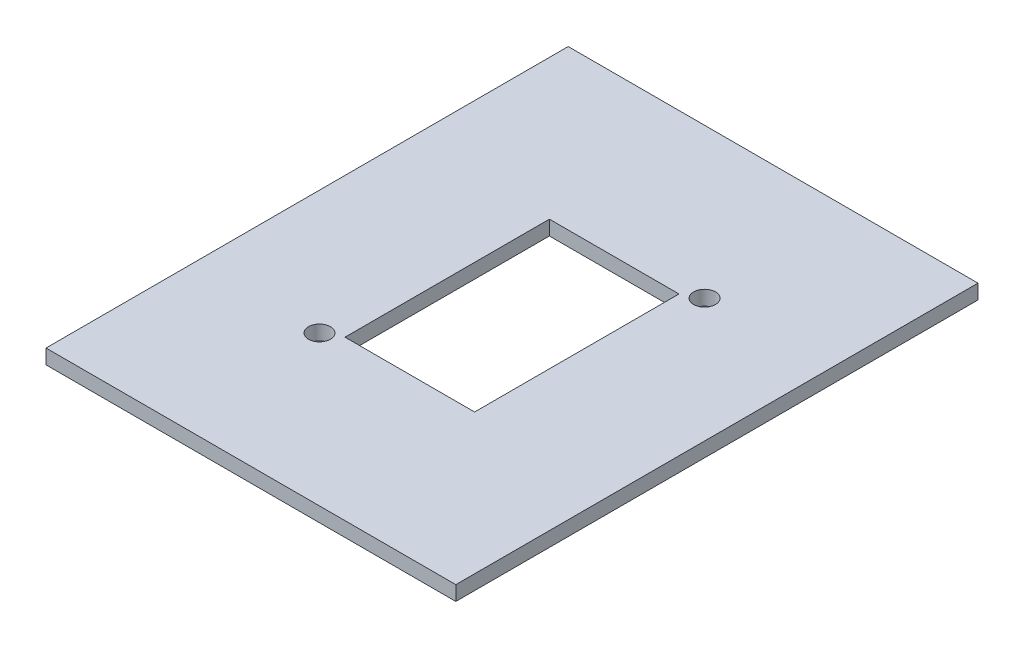
from build123d import *

# Parameters (mm, degrees)
SKETCH1_W           = 56.13529043
SKETCH1_H           = 71.529878814
SKETCH1_R           = 1.5
SKETCH1_W_2         = 17.75
SKETCH1_H_2         = 28
BOSS_EXTRUDE1_DEPTH = 2


with BuildPart() as part:
    # Sketch1 → Boss-Extrude1 (new body)
    with BuildSketch(Plane(origin=(0, 0, 0), x_dir=(1, 0, 0), z_dir=(0, 1, 0))):
        Rectangle(SKETCH1_W, SKETCH1_H)
        with Locations((11.125, 15.25)):
            Circle(SKETCH1_R, mode=Mode.SUBTRACT)
        with Locations((-11.125, -15.25)):
            Circle(SKETCH1_R, mode=Mode.SUBTRACT)
        Rectangle(SKETCH1_W_2, SKETCH1_H_2, mode=Mode.SUBTRACT)
    extrude(amount=BOSS_EXTRUDE1_DEPTH)


solid = part.part
